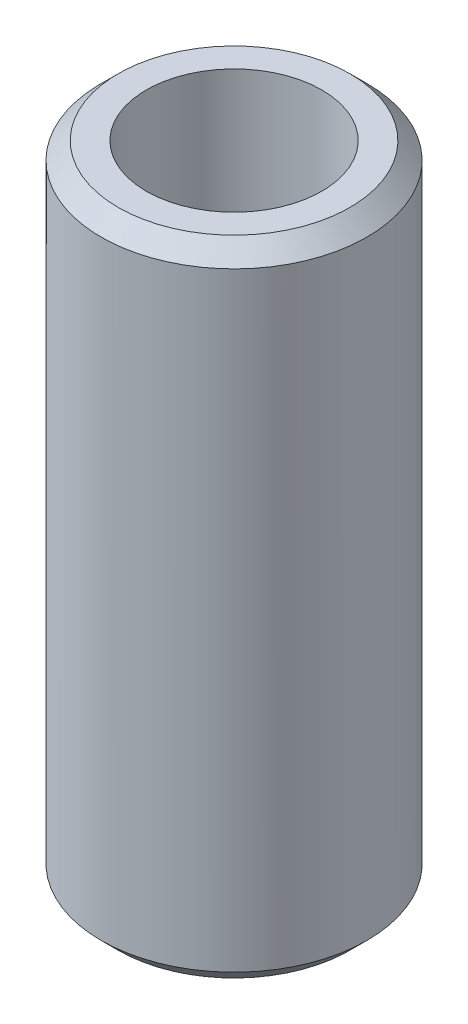
from build123d import *

# Parameters (mm, degrees)
SKETCH1_R           = 30
BOSS_EXTRUDE1_DEPTH = 145.135448417
SKETCH2_R           = 19.805481705
CUT_EXTRUDE1_DEPTH  = 152.209452043
CHAMFER1_SIZE       = 3.859142132


with BuildPart() as part:
    # Sketch1 → Boss-Extrude1 (new body)
    with BuildSketch(Plane(origin=(0, 0, 0), x_dir=(1, 0, 0), z_dir=(0, 1, 0))):
        Circle(SKETCH1_R)
    extrude(amount=BOSS_EXTRUDE1_DEPTH)

    # Sketch2 → Cut-Extrude1 (cut, through all)
    with BuildSketch(Plane(origin=(0, 0, 0), x_dir=(1, 0, 0), z_dir=(0, 1, 0))):
        Circle(SKETCH2_R)
    extrude(amount=CUT_EXTRUDE1_DEPTH, mode=Mode.SUBTRACT)

    # Chamfer1
    chamfer1_edges = [part.edges().sort_by_distance(p)[0] for p in [
        (-30, 145.135448417, 0),
        (-30, 0, 0),
    ]]
    chamfer(chamfer1_edges, length=CHAMFER1_SIZE)


solid = part.part
